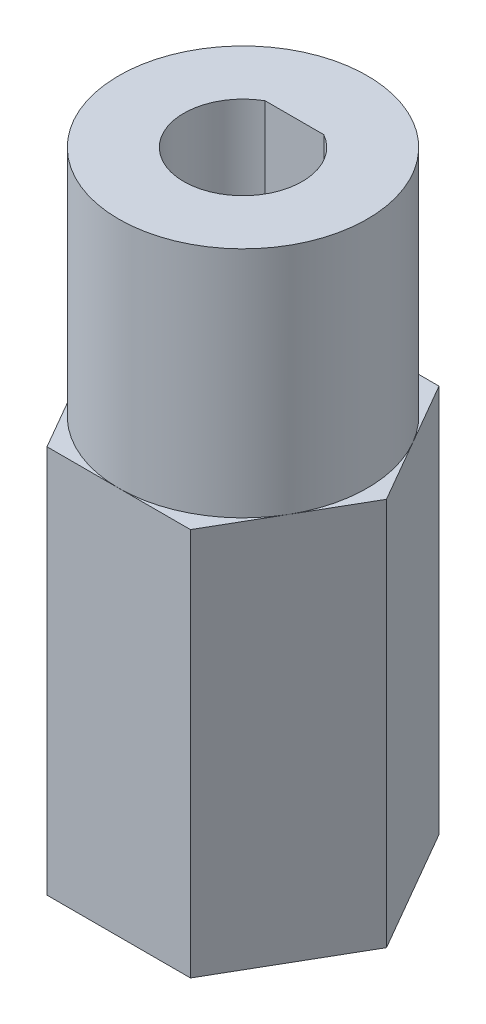
from build123d import *

# Parameters (mm, degrees)
SKETCH1_R           = 1.35
BOSS_EXTRUDE1_DEPTH = 20
SKETCH2_R           = 6.4
SKETCH2_R_2         = 3.05
BOSS_EXTRUDE2_DEPTH = 12
BOSS_EXTRUDE3_REACH = 35.46
SKETCH5_R           = 1.5
CUT_EXTRUDE1_DEPTH  = 12


with BuildPart() as part:
    # Sketch1 → Boss-Extrude1 (new body)
    with BuildSketch(Plane(origin=(0, 0, 0), x_dir=(1, 0, 0), z_dir=(0, 1, 0))):
        Polygon((3.695041723, -6.4), (7.390083446, 0), (3.695041723, 6.4), (-3.695041723, 6.4), (-7.390083446, 0), (-3.695041723, -6.4), align=None)
        Circle(SKETCH1_R, mode=Mode.SUBTRACT)
    extrude(amount=BOSS_EXTRUDE1_DEPTH)

    # Sketch2 → Boss-Extrude2 (add)
    with BuildSketch(Plane(origin=(0, 20, 0), x_dir=(1, 0, 0), z_dir=(0, 1, 0))):
        Circle(SKETCH2_R)
        Circle(SKETCH2_R_2, mode=Mode.SUBTRACT)
    extrude(amount=BOSS_EXTRUDE2_DEPTH)

    # Sketch3 → Boss-Extrude3 (add, up to next)
    with BuildSketch(Plane(origin=(0, 32, 0), x_dir=(1, 0, 0), z_dir=(0, 1, 0)), mode=Mode.PRIVATE) as boss_extrude3_sk1:
        with BuildLine():
            Line((-1.509966887, 2.65), (1.509966887, 2.65))
            ThreePointArc((1.509966887, 2.65), (0, 3.05), (-1.509966887, 2.65))
        make_face()
    boss_extrude3_tool1 = extrude(boss_extrude3_sk1.sketch, amount=-BOSS_EXTRUDE3_REACH, mode=Mode.PRIVATE) - part.part
    add(boss_extrude3_tool1.solids().sort_by_distance((0, 32, -2.810935))[0])

    # Sketch5 → Cut-Extrude1 (cut)
    with BuildSketch(Plane.XY.offset(-2.65)):
        with Locations((0, 27)):
            Circle(SKETCH5_R)
    extrude(amount=-CUT_EXTRUDE1_DEPTH, mode=Mode.SUBTRACT)


solid = part.part
